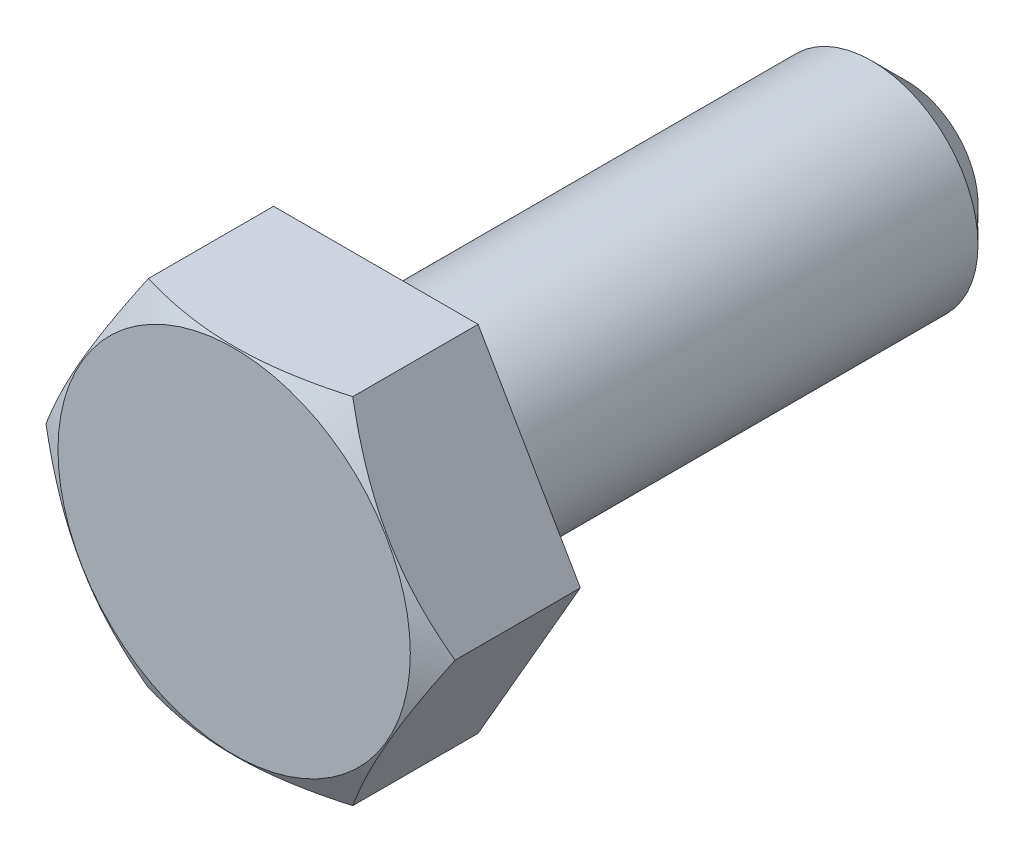
from build123d import *

# Parameters (mm, degrees)
EXTRUDE_1_DEPTH = 4
SKETCH_2_R      = 3
EXTRUDE_2_DEPTH = 15
CHAMFER_1_SIZE  = 1


with BuildPart() as part:
    # Эскиз1 → Бобышка-Вытянуть1 (new body)
    with BuildSketch(Plane.XY):
        Polygon((5.773502692, 0), (2.886751346, 5), (-2.886751346, 5), (-5.773502692, 0), (-2.886751346, -5), (2.886751346, -5), align=None)
    extrude(amount=EXTRUDE_1_DEPTH)

    # Эскиз2 → Бобышка-Вытянуть2 (add)
    with BuildSketch(Plane(origin=(0, 0, 0), x_dir=(-1, 0, 0), z_dir=(0, 0, -1))):
        Circle(SKETCH_2_R)
    extrude(amount=EXTRUDE_2_DEPTH)

    # Фаска1
    chamfer_1_edges = [part.edges().sort_by_distance(p)[0] for p in [
        (3, 0, -15),
    ]]
    chamfer(chamfer_1_edges, length=CHAMFER_1_SIZE)

    # Эскиз3 → Вырез-Повернуть1 (revolve, cut)
    with BuildSketch(Plane(origin=(0, 0, 0), x_dir=(1, 0, 0), z_dir=(0, 1, 0))):
        Polygon((-10.773502692, -0.651368439), (-4.973502692, -4), (-10.773502692, -4), align=None)
    revolve(axis=Axis((0, 0, 4), (0, 0, -1)), mode=Mode.SUBTRACT)


solid = part.part
